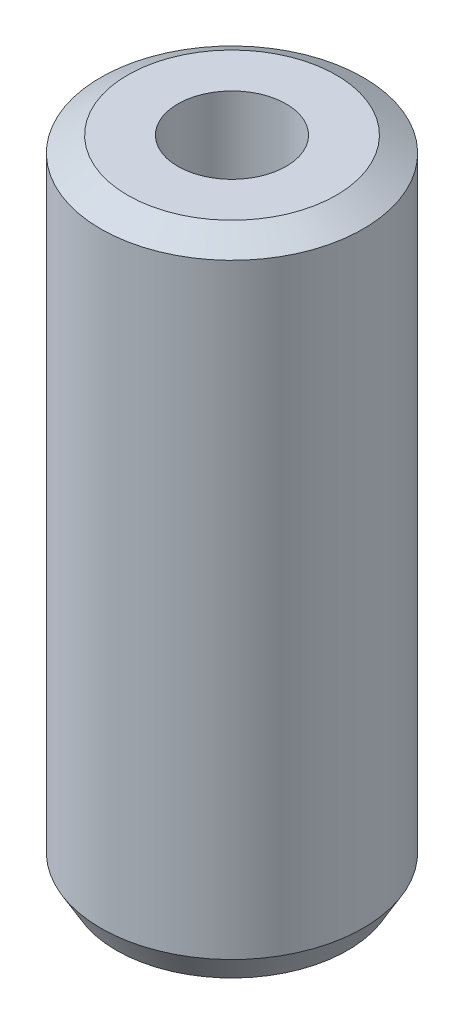
from build123d import *
from OCP.BRepFilletAPI import BRepFilletAPI_MakeChamfer

# Parameters (mm, degrees)
SKETCH1_R           = 47.5
BOSS_EXTRUDE1_DEPTH = 234.52447534
SKETCH2_R           = 19.597100249
CUT_EXTRUDE1_DEPTH  = 244.955384309
CHAMFER1_SIZE       = 5.645238696
CHAMFER1_SIZE2      = 9.777840243


with BuildPart() as part:
    # Sketch1 → Boss-Extrude1 (new body)
    with BuildSketch(Plane(origin=(0, 0, 0), x_dir=(1, 0, 0), z_dir=(0, 1, 0))):
        Circle(SKETCH1_R)
    extrude(amount=BOSS_EXTRUDE1_DEPTH)

    # Sketch2 → Cut-Extrude1 (cut, through all)
    with BuildSketch(Plane(origin=(0, 0, 0), x_dir=(1, 0, 0), z_dir=(0, 1, 0))):
        Circle(SKETCH2_R)
    extrude(amount=CUT_EXTRUDE1_DEPTH, mode=Mode.SUBTRACT)

    # Chamfer1: one chamfer whose edges measure the first distance from different faces: ONE call of the kernel's chamfer builder (chamfer() names one face for all edges)
    chamfer1_edges_1 = [part.edges().sort_by_distance(p)[0] for p in [
        (-47.5, 234.52447534, 0),
    ]]
    chamfer1_side_1 = [part.faces().sort_by_distance(p)[0] for p in [
        (-47.5, 117.26223767, 0),
    ]]
    chamfer1_edges_2 = [part.edges().sort_by_distance(p)[0] for p in [
        (-47.5, 0, 0),
    ]]
    chamfer1_side_2 = [part.faces().sort_by_distance(p)[0] for p in [
        (-46.156497116, 0, 0),
    ]]
    chamfer1 = BRepFilletAPI_MakeChamfer(part.part.solid().wrapped)
    for e in chamfer1_edges_1:
        chamfer1.Add(CHAMFER1_SIZE, CHAMFER1_SIZE2, e.wrapped, chamfer1_side_1[0].wrapped)  # the first distance lies on this face
    for e in chamfer1_edges_2:
        chamfer1.Add(CHAMFER1_SIZE, CHAMFER1_SIZE2, e.wrapped, chamfer1_side_2[0].wrapped)  # the first distance lies on this face
    add(Compound.cast(chamfer1.Shape()), mode=Mode.REPLACE)


solid = part.part
